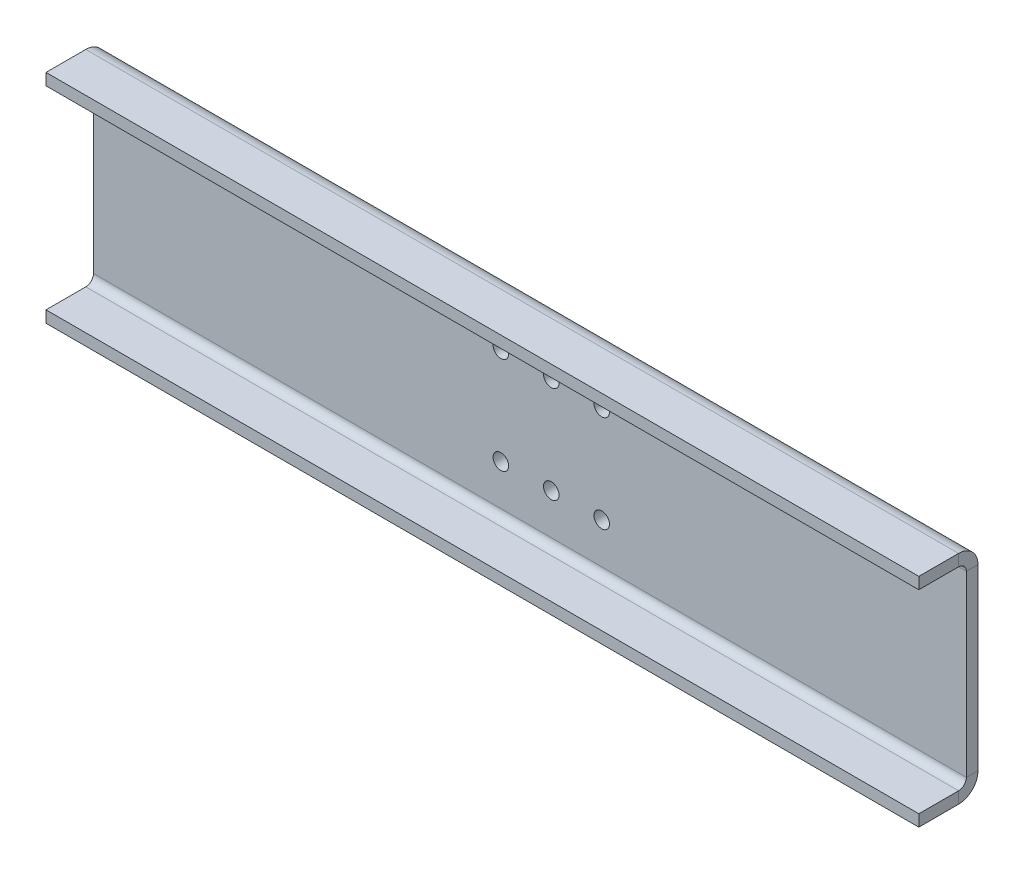
from build123d import *

# Parameters (mm, degrees)
SKETCH1_W                  = 225
SKETCH1_H                  = 77.5
SKETCH1_R                  = 2
BOSS_EXTRUDE1_DEPTH        = 3
SKETCHED_START             = -27.618786464
SKETCHED_BEND1_OUTLINE_W   = 225
SKETCHED_BEND1_OUTLINE_H   = 3
SKETCHED_BEND1_DEPTH       = 62.248893571
SKETCHED_START_2           = 35.116407107
SKETCHED_BEND1_2_OUTLINE_W = 225
SKETCHED_BEND1_2_OUTLINE_H = 50.002212856
SKETCHED_BEND1_2_OUTLINE_R = 2
SKETCHED_BEND1_2_DEPTH     = 2.5137
SKETCHED_START_3           = 39.630107107
SKETCHED_BEND1_3_OUTLINE_W = 225
SKETCHED_BEND1_3_OUTLINE_H = 3
SKETCHED_BEND1_3_DEPTH     = 10.251106429
SKETCHED_START_4           = 34.630107107
SKETCHED_BEND1_4_OUTLINE_W = 225
SKETCHED_BEND1_4_OUTLINE_H = 3
SKETCHED_BEND1_4_DEPTH     = 0.28314
SKETCHED_BEND1_5_OUTLINE_W = 225
SKETCHED_BEND1_5_OUTLINE_H = 50.002212856
SKETCHED_BEND1_5_OUTLINE_R = 2
SKETCHED_BEND1_5_DEPTH     = 5
SKETCHED_START_5           = -66.5
SKETCHED_BEND1_6_DEPTH     = 225
SKETCHED_BEND1_7_DEPTH     = 225


with BuildPart() as part:
    # Sketch1 → Boss-Extrude1 (new body)
    with BuildSketch(Plane(origin=(0, 0, 0), x_dir=(1, 0, 0), z_dir=(0, 1, 0))):
        with Locations((46, -11.131213536)):
            Rectangle(SKETCH1_W, SKETCH1_H)
        with Locations(Location((38.5, 1.368786464, 0), (0, 0, 270))):
            Circle(SKETCH1_R, mode=Mode.SUBTRACT)
        with Locations(Location((38.5, -23.631213536, 0), (0, 0, 90))):
            Circle(SKETCH1_R, mode=Mode.SUBTRACT)
        with Locations(Location((51.5, 1.368786464, 0), (0, 0, 270))):
            Circle(SKETCH1_R, mode=Mode.SUBTRACT)
        with Locations(Location((51.5, -23.631213536, 0), (0, 0, 90))):
            Circle(SKETCH1_R, mode=Mode.SUBTRACT)
        with Locations(Location((64.5, 1.368786464, 0), (0, 0, 270))):
            Circle(SKETCH1_R, mode=Mode.SUBTRACT)
        with Locations(Location((64.5, -23.631213536, 0), (0, 0, 90))):
            Circle(SKETCH1_R, mode=Mode.SUBTRACT)
    extrude(amount=BOSS_EXTRUDE1_DEPTH)

    # Sketched Bend1: read off the stored shape, not the designer's step
    # Sketched Bend1 outline → Sketched Bend1 (cut)
    with BuildSketch(Plane.XY.offset(SKETCHED_START)):
        with Locations((46, 1.5)):
            Rectangle(SKETCHED_BEND1_OUTLINE_W, SKETCHED_BEND1_OUTLINE_H)
    extrude(amount=SKETCHED_BEND1_DEPTH, mode=Mode.SUBTRACT)

    # Sketched Bend1 2 outline → Sketched Bend1 2 (add)
    with BuildSketch(Plane.XY.offset(SKETCHED_START_2)):
        with Locations((46, 28.001106428)):
            Rectangle(SKETCHED_BEND1_2_OUTLINE_W, SKETCHED_BEND1_2_OUTLINE_H)
        with Locations((38.5, 15.501106428)):
            Circle(SKETCHED_BEND1_2_OUTLINE_R, mode=Mode.SUBTRACT)
        with Locations((51.5, 15.501106428)):
            Circle(SKETCHED_BEND1_2_OUTLINE_R, mode=Mode.SUBTRACT)
        with Locations((64.5, 15.501106428)):
            Circle(SKETCHED_BEND1_2_OUTLINE_R, mode=Mode.SUBTRACT)
        with Locations((38.5, 40.501106428)):
            Circle(SKETCHED_BEND1_2_OUTLINE_R, mode=Mode.SUBTRACT)
        with Locations((51.5, 40.501106428)):
            Circle(SKETCHED_BEND1_2_OUTLINE_R, mode=Mode.SUBTRACT)
        with Locations((64.5, 40.501106428)):
            Circle(SKETCHED_BEND1_2_OUTLINE_R, mode=Mode.SUBTRACT)
    extrude(amount=SKETCHED_BEND1_2_DEPTH)

    # Sketched Bend1 4 outline → Sketched Bend1 4 (cut)
    with BuildSketch(Plane.XY.offset(SKETCHED_START_4)):
        with Locations((46, 1.5)):
            Rectangle(SKETCHED_BEND1_4_OUTLINE_W, SKETCHED_BEND1_4_OUTLINE_H)
    extrude(amount=SKETCHED_BEND1_4_DEPTH, mode=Mode.SUBTRACT)



with BuildPart() as body_2:
    # Sketched Bend1 3 outline → Sketched Bend1 3 (new body)
    with BuildSketch(Plane.XY.offset(SKETCHED_START_3)):
        with Locations((46, 54.502212856)):
            Rectangle(SKETCHED_BEND1_3_OUTLINE_W, SKETCHED_BEND1_3_OUTLINE_H)
    extrude(amount=SKETCHED_BEND1_3_DEPTH)


with BuildPart() as part_1:
    add(part.part)

    add(body_2.part)  # Sketched Bend1 5 merges body 2
    # Sketched Bend1 5 outline → Sketched Bend1 5 (add)
    with BuildSketch(Plane.XY.offset(SKETCHED_START_4)):
        with Locations((46, 28.001106428)):
            Rectangle(SKETCHED_BEND1_5_OUTLINE_W, SKETCHED_BEND1_5_OUTLINE_H)
        with Locations((38.5, 15.501106428)):
            Circle(SKETCHED_BEND1_5_OUTLINE_R, mode=Mode.SUBTRACT)
        with Locations((51.5, 15.501106428)):
            Circle(SKETCHED_BEND1_5_OUTLINE_R, mode=Mode.SUBTRACT)
        with Locations((64.5, 15.501106428)):
            Circle(SKETCHED_BEND1_5_OUTLINE_R, mode=Mode.SUBTRACT)
        with Locations((38.5, 40.501106428)):
            Circle(SKETCHED_BEND1_5_OUTLINE_R, mode=Mode.SUBTRACT)
        with Locations((51.5, 40.501106428)):
            Circle(SKETCHED_BEND1_5_OUTLINE_R, mode=Mode.SUBTRACT)
        with Locations((64.5, 40.501106428)):
            Circle(SKETCHED_BEND1_5_OUTLINE_R, mode=Mode.SUBTRACT)
    extrude(amount=SKETCHED_BEND1_5_DEPTH)

    # Sketched Bend1 6 outline → Sketched Bend1 6 (cut)
    with BuildSketch(Plane.YZ.offset(SKETCHED_START_5)):
        with BuildLine():
            Line((3, 34.630107107), (5, 34.630107107))
            ThreePointArc((5, 34.630107107), (1.464466094, 36.094573201), (0, 39.630107107))
            Line((0, 39.630107107), (0, 34.913247107))
            Line((0, 34.913247107), (3, 34.913247107))
            Line((3, 34.913247107), (3, 34.630107107))
        make_face()
        with BuildLine():
            Line((53.002212856, 34.630107107), (53.002212856, 35.047531413))
            ThreePointArc((53.002212856, 35.047531413), (52.023761074, 34.735575543), (51.002212856, 34.630107107))
            Line((51.002212856, 34.630107107), (53.002212856, 34.630107107))
        make_face()
        with BuildLine():
            Line((5, 37.630107107), (51.002212856, 37.630107107))
            ThreePointArc((51.002212856, 37.630107107), (52.416426419, 38.215893545), (53.002212856, 39.630107107))
            Line((53.002212856, 39.630107107), (3, 39.630107107))
            ThreePointArc((3, 39.630107107), (3.585786438, 38.215893545), (5, 37.630107107))
        make_face()
    extrude(amount=SKETCHED_BEND1_6_DEPTH, mode=Mode.SUBTRACT)

    # Sketched Bend1 7 outline → Sketched Bend1 7 (add)
    with BuildSketch(Plane.YZ.offset(SKETCHED_START_5)):
        with BuildLine():
            Line((56.002212856, 39.630107107), (53.002212856, 39.630107107))
            Line((53.002212856, 39.630107107), (53.002212856, 35.047531413))
            ThreePointArc((53.002212856, 35.047531413), (55.185512988, 36.89149432), (56.002212856, 39.630107107))
        make_face()
    extrude(amount=SKETCHED_BEND1_7_DEPTH)


solid = part_1.part
